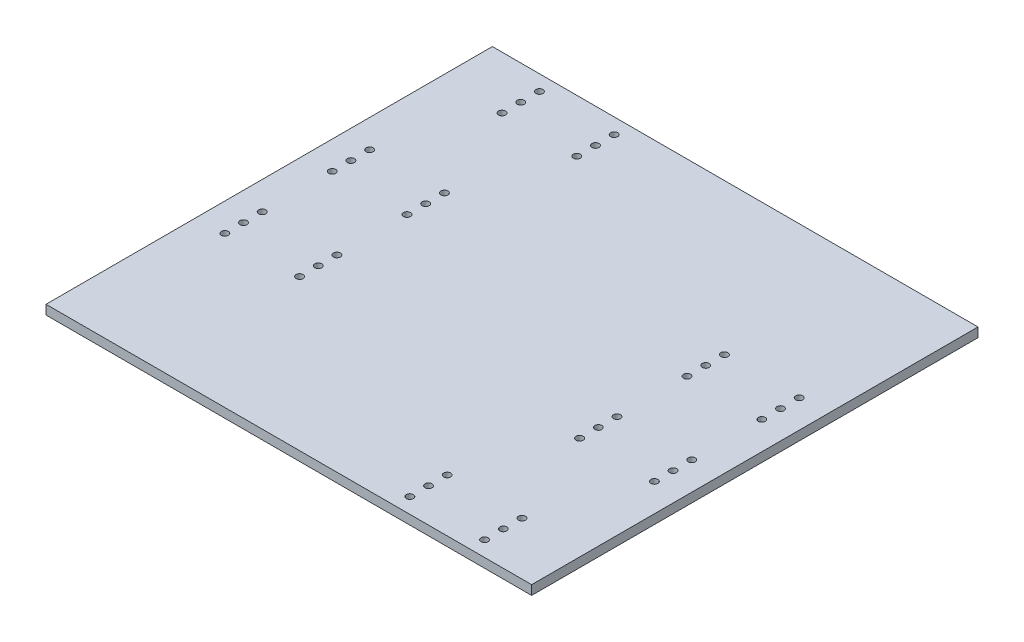
from build123d import *

# Parameters (mm, degrees)
CROQUIS1_W              = 330
CROQUIS1_H              = 303.31
SALIENTE_EXTRUIR2_DEPTH = 6.35
CROQUIS4_R              = 2.38125
CORTAR_EXTRUIR1_DEPTH   = 10


with BuildPart() as part:
    # Croquis1 → Saliente-Extruir2 (new body)
    with BuildSketch(Plane(origin=(0, 0, 0), x_dir=(1, 0, 0), z_dir=(0, 1, 0))):
        Rectangle(CROQUIS1_W, CROQUIS1_H)
    extrude(amount=SALIENTE_EXTRUIR2_DEPTH)

    # Croquis4 → Cortar-Extruir1 (cut)
    with BuildSketch(Plane(origin=(0, 6.35, 0), x_dir=(1, 0, 0), z_dir=(0, 1, 0))):
        with Locations((122.58, -128.507)):
            Circle(CROQUIS4_R)
        with Locations((122.58, -115.807)):
            Circle(CROQUIS4_R)
        with Locations((122.58, -141.207)):
            Circle(CROQUIS4_R)
        with Locations((71.78, -141.207)):
            Circle(CROQUIS4_R)
        with Locations((71.78, -128.507)):
            Circle(CROQUIS4_R)
        with Locations((71.78, -115.807)):
            Circle(CROQUIS4_R)
        with Locations((95.15, -36.499)):
            Circle(CROQUIS4_R)
        with Locations((95.15, -23.799)):
            Circle(CROQUIS4_R)
        with Locations((95.15, -49.199)):
            Circle(CROQUIS4_R)
        with Locations((145.95, -49.199)):
            Circle(CROQUIS4_R)
        with Locations((145.95, -36.499)):
            Circle(CROQUIS4_R)
        with Locations((145.95, -23.799)):
            Circle(CROQUIS4_R)
        with Locations((145.95, 49.199)):
            Circle(CROQUIS4_R)
        with Locations((95.15, 49.199)):
            Circle(CROQUIS4_R)
        with Locations((145.95, 36.499)):
            Circle(CROQUIS4_R)
        with Locations((95.15, 36.499)):
            Circle(CROQUIS4_R)
        with Locations((145.95, 23.799)):
            Circle(CROQUIS4_R)
        with Locations((95.15, 23.799)):
            Circle(CROQUIS4_R)
        with Locations((-95.15, -49.199)):
            Circle(CROQUIS4_R)
        with Locations((-145.95, -49.199)):
            Circle(CROQUIS4_R)
        with Locations((-145.95, -36.499)):
            Circle(CROQUIS4_R)
        with Locations((-95.15, -36.499)):
            Circle(CROQUIS4_R)
        with Locations((-95.15, -23.799)):
            Circle(CROQUIS4_R)
        with Locations((-145.95, -23.799)):
            Circle(CROQUIS4_R)
        with Locations((-145.95, 49.199)):
            Circle(CROQUIS4_R)
        with Locations((-145.95, 36.499)):
            Circle(CROQUIS4_R)
        with Locations((-145.95, 23.799)):
            Circle(CROQUIS4_R)
        with Locations((-95.15, 23.799)):
            Circle(CROQUIS4_R)
        with Locations((-95.15, 36.499)):
            Circle(CROQUIS4_R)
        with Locations((-95.15, 49.199)):
            Circle(CROQUIS4_R)
        with Locations((-122.58, 115.807)):
            Circle(CROQUIS4_R)
        with Locations((-122.58, 128.507)):
            Circle(CROQUIS4_R)
        with Locations((-122.58, 141.207)):
            Circle(CROQUIS4_R)
        with Locations((-71.78, 115.807)):
            Circle(CROQUIS4_R)
        with Locations((-71.78, 128.507)):
            Circle(CROQUIS4_R)
        with Locations((-71.78, 141.207)):
            Circle(CROQUIS4_R)
    extrude(amount=-CORTAR_EXTRUIR1_DEPTH, mode=Mode.SUBTRACT)


solid = part.part
